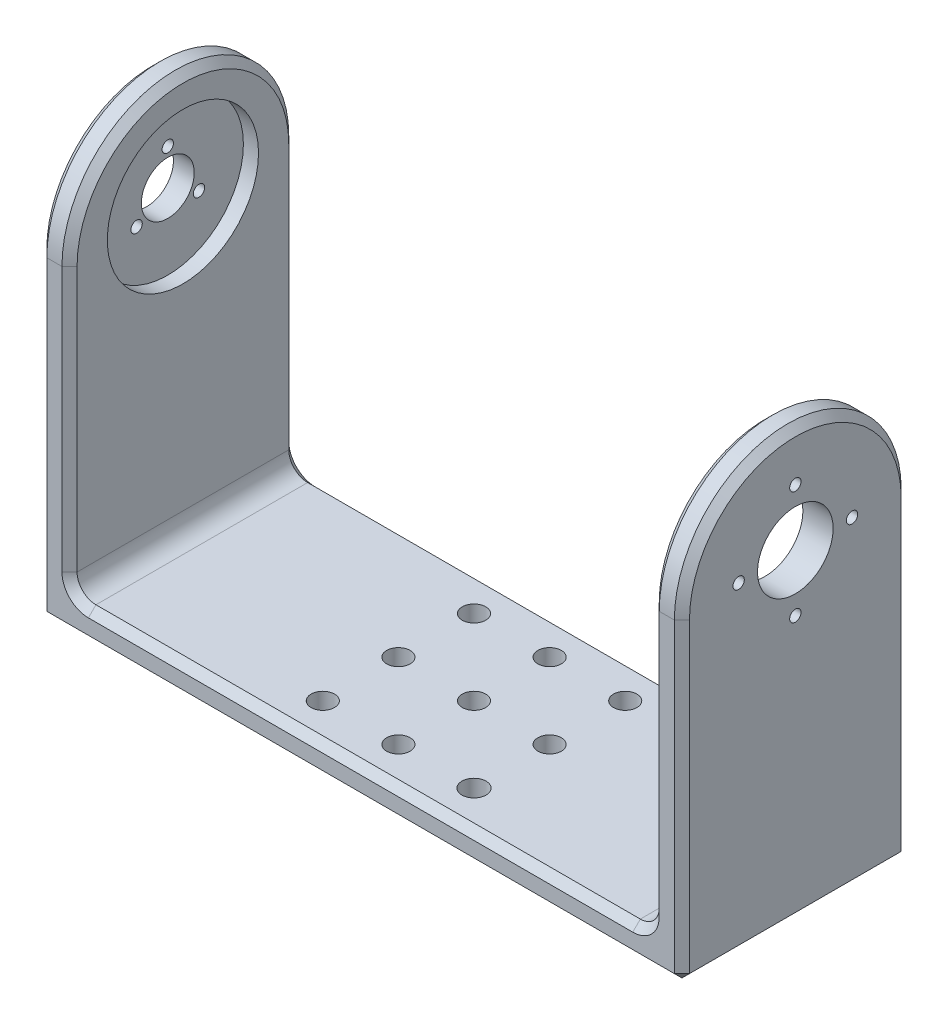
from build123d import *

# Parameters (mm, degrees)
SKETCH1_W           = 170
SKETCH1_H           = 60
BOSS_EXTRUDE1_DEPTH = 8
SKETCH2_W           = 8
SKETCH2_H           = 60
BOSS_EXTRUDE2_DEPTH = 105
SKETCH3_R           = 10
SKETCH3_R_2         = 1.5
CUT_EXTRUDE1_DEPTH  = 10
SKETCH5_R           = 17
BOSS_EXTRUDE3_DEPTH = 1.5
SKETCH6_R           = 7
CUT_EXTRUDE3_DEPTH  = 15
SKETCH7_R           = 20
CUT_EXTRUDE4_DEPTH  = 4
FILLET1_RADIUS      = 30
FILLET1_LENGTH      = 8
FILLET2_RADIUS      = 30
FILLET2_LENGTH      = 8
FILLET3_R           = 5
FILLET4_R           = 5
CHAMFER1_SIZE       = 2
SKETCH8_R           = 3.1
SKETCH8_R_2         = 3.2
CUT_EXTRUDE5_DEPTH  = 10
SKETCH10_R          = 1.5
CUT_EXTRUDE7_DEPTH  = 10
CHAMFER2_SIZE       = 1


with BuildPart() as part:
    # Sketch1 → Boss-Extrude1 (new body)
    with BuildSketch(Plane(origin=(0, 0, 0), x_dir=(1, 0, 0), z_dir=(0, 1, 0))):
        Rectangle(SKETCH1_W, SKETCH1_H)
    extrude(amount=BOSS_EXTRUDE1_DEPTH)

    # Sketch2 → Boss-Extrude2 (add)
    with BuildSketch(Plane(origin=(0, 8, 0), x_dir=(1, 0, 0), z_dir=(0, 1, 0))):
        with Locations((-81, 0)):
            Rectangle(SKETCH2_W, SKETCH2_H)
        with Locations((81, 0)):
            Rectangle(SKETCH2_W, SKETCH2_H)
    extrude(amount=BOSS_EXTRUDE2_DEPTH)

    # Sketch3 → Cut-Extrude1 (cut)
    with BuildSketch(Plane(origin=(85, 0, 0), x_dir=(0, 0, -1), z_dir=(1, 0, 0))):
        with Locations((0, 85)):
            Circle(SKETCH3_R)
        with Locations((0, 70)):
            Circle(SKETCH3_R_2)
        with Locations((0, 100)):
            Circle(SKETCH3_R_2)
        with Locations((-15, 85)):
            Circle(SKETCH3_R_2)
        with Locations((15, 85)):
            Circle(SKETCH3_R_2)
    extrude(amount=-CUT_EXTRUDE1_DEPTH, mode=Mode.SUBTRACT)

    # Sketch5 → Boss-Extrude3 (add)
    with BuildSketch(Plane.ZY.offset(85)):
        with Locations(Location((0, 85, 0), (0, 0, 180))):
            Circle(SKETCH5_R)
    extrude(amount=BOSS_EXTRUDE3_DEPTH)

    # Sketch6 → Cut-Extrude3 (cut)
    with BuildSketch(Plane.ZY.offset(86.5)):
        with Locations((0, 85)):
            Circle(SKETCH6_R)
    extrude(amount=-CUT_EXTRUDE3_DEPTH, mode=Mode.SUBTRACT)

    # Sketch7 → Cut-Extrude4 (cut)
    with BuildSketch(Plane(origin=(-77, 0, 0), x_dir=(0, 0, -1), z_dir=(1, 0, 0))):
        with Locations((0, 85)):
            Circle(SKETCH7_R)
    extrude(amount=-CUT_EXTRUDE4_DEPTH, mode=Mode.SUBTRACT)

    # Fillet1: full round fillet: the end face becomes a half cylinder, R = half its width
    fillet1_face = Plane((81, 113, 0), x_dir=(-1, 0, 0), z_dir=(0, 1, 0))  # on the end face: x along it, z out of the body
    fillet1_slab = fillet1_face.offset(-FILLET1_RADIUS / 2) * Box(FILLET1_LENGTH, 2 * FILLET1_RADIUS, FILLET1_RADIUS, mode=Mode.PRIVATE)  # the body's end, R deep
    fillet1_round = Plane((81, 83, 0), x_dir=(0, 1, 0), z_dir=(-1, 0, 0)) * Cylinder(FILLET1_RADIUS, FILLET1_LENGTH, mode=Mode.PRIVATE)  # its axis R under the face
    add(fillet1_slab - fillet1_round, mode=Mode.SUBTRACT)

    # Fillet2: full round fillet: the end face becomes a half cylinder, R = half its width
    fillet2_face = Plane((-81, 113, 0), x_dir=(1, 0, 0), z_dir=(0, 1, 0))  # on the end face: x along it, z out of the body
    fillet2_slab = fillet2_face.offset(-FILLET2_RADIUS / 2) * Box(FILLET2_LENGTH, 2 * FILLET2_RADIUS, FILLET2_RADIUS, mode=Mode.PRIVATE)  # the body's end, R deep
    fillet2_round = Plane((-81, 83, 0), x_dir=(0, 1, 0), z_dir=(1, 0, 0)) * Cylinder(FILLET2_RADIUS, FILLET2_LENGTH, mode=Mode.PRIVATE)  # its axis R under the face
    add(fillet2_slab - fillet2_round, mode=Mode.SUBTRACT)

    # Fillet3
    fillet3_edges = [part.edges().sort_by_distance(p)[0] for p in [
        (77, 8, 0),
    ]]
    fillet(fillet3_edges, radius=FILLET3_R)

    # Fillet4
    fillet4_edges = [part.edges().sort_by_distance(p)[0] for p in [
        (-77, 8, 0),
    ]]
    fillet(fillet4_edges, radius=FILLET4_R)

    # Chamfer1
    chamfer1_edges = [part.edges().sort_by_distance(p)[0] for p in [
        (75.535533906, 9.464466094, -30),
        (75.535533906, 9.464466094, 30),
        (0, 8, 30),
        (-75.535533906, 9.464466094, 30),
        (-75.535533906, 9.464466094, -30),
        (0, 0, -30),
        (85, 0, 0),
        (0, 0, 30),
        (-85, 0, 0),
        (77, 48, -30),
        (85, 41.5, -30),
        (85, 41.5, 30),
        (77, 48, 30),
        (77, 113, 0),
        (85, 113, 0),
        (-85, 41.5, -30),
        (-77, 48, -30),
        (-77, 48, 30),
        (-85, 41.5, 30),
        (-85, 113, 0),
        (-77, 113, 0),
        (0, 8, -30),
    ]]
    chamfer(chamfer1_edges, length=CHAMFER1_SIZE)

    # Sketch8 → Cut-Extrude5 (cut)
    with BuildSketch(Plane(origin=(0, 8, 0), x_dir=(1, 0, 0), z_dir=(0, 1, 0))):
        with Locations(Location((0, 0, 0), (0, 0, 270))):
            Circle(SKETCH8_R)
        with Locations(Location((0, 20, 0), (0, 0, 270))):
            Circle(SKETCH8_R)
        with Locations(Location((0, -20, 0), (0, 0, 270))):
            Circle(SKETCH8_R)
        with Locations(Location((-20, -20, 0), (0, 0, 270))):
            Circle(SKETCH8_R)
        with Locations(Location((-20, 20, 0), (0, 0, 270))):
            Circle(SKETCH8_R)
        with Locations(Location((-20, 0, 0), (0, 0, 270))):
            Circle(SKETCH8_R)
        with Locations(Location((20, -20, 0), (0, 0, 270))):
            Circle(SKETCH8_R_2)
        with Locations(Location((20, 0, 0), (0, 0, 270))):
            Circle(SKETCH8_R)
        with Locations(Location((20, 20, 0), (0, 0, 270))):
            Circle(SKETCH8_R)
    extrude(amount=-CUT_EXTRUDE5_DEPTH, mode=Mode.SUBTRACT)

    # Sketch10 → Cut-Extrude7 (cut)
    with BuildSketch(Plane(origin=(-81, 0, 0), x_dir=(0, 0, -1), z_dir=(1, 0, 0))):
        with Locations((0, 94.525)):
            Circle(SKETCH10_R)
        with Locations((8.248891971, 80.2375)):
            Circle(SKETCH10_R)
        with Locations((-8.248891971, 80.2375)):
            Circle(SKETCH10_R)
    extrude(amount=-CUT_EXTRUDE7_DEPTH, mode=Mode.SUBTRACT)

    # Chamfer2
    chamfer2_edges = [part.edges().sort_by_distance(p)[0] for p in [
        (-85, 85, 17),
    ]]
    chamfer(chamfer2_edges, length=CHAMFER2_SIZE)


solid = part.part
